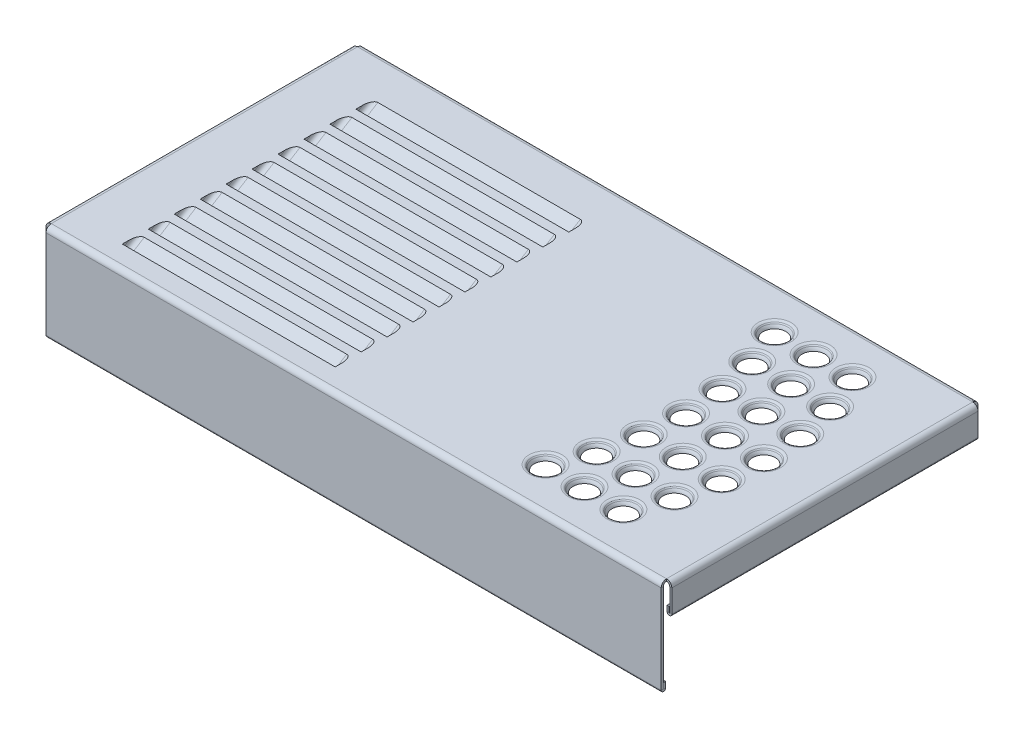
from build123d import *

# Parameters (mm, degrees)
SKETCH2_W               = 237
SKETCH2_H               = 0.8
BASE_FLANGE1_DEPTH      = 35
EDGE_FLANGE1_DEPTH      = 237
HEM1_START              = -118.5
HEM1_DEPTH              = 237
HEM1_2_DEPTH            = 237
EDGE_FLANGE2_DEPTH      = 237
EDGE_FLANGE3_DEPTH      = 117.95
EDGE_FLANGE3_BEND_DEPTH = 117.95
HEM2_START              = -119.2
HEM2_DEPTH              = 117.95
BOSS_EXTRUDE1_DEPTH     = 41.5
CUT_EXTRUDE1_DEPTH      = 41
FILLET2_R               = 2
LPATTERN2_COUNT         = 10
LPATTERN2_PITCH         = 10
FILLET2_OF_LPATTERN2_R  = 2
FILLET1_R               = 1.5
LPATTERN1_COUNT         = 3
LPATTERN1_PITCH         = 15
FILLET1_OF_LPATTERN1_R  = 1.5


# Read off the part's stored shape, not the designer's step: Hem1, Hem2, CrvPattern1
# Sheet-metal steps are written as plain solids
with BuildPart() as part:
    # Sketch2 → Base-Flange1 (new body)
    with BuildSketch(Plane(origin=(0, 0, 0), x_dir=(1, 0, 0), z_dir=(0, 1, 0))):
        with Locations((0, -0.4)):
            Rectangle(SKETCH2_W, SKETCH2_H)
    extrude(amount=BASE_FLANGE1_DEPTH)

    # Edge-Flange1 section (across the edge) → Edge-Flange1 (add)
    with BuildSketch(Plane(origin=(-118.5, 36.25, 0), x_dir=(0, -1, 0), z_dir=(1, 0, 0))):
        with BuildLine():
            Line((-0.8, 1.25), (-0.8, 119.2))
            Line((-0.8, 119.2), (0, 119.2))
            Line((0, 119.2), (0, 1.25))
            ThreePointArc((0, 1.25), (0.366116524, 0.366116524), (1.25, 0))
            Line((1.25, 0), (1.25, -0.8))
            ThreePointArc((1.25, -0.8), (-0.199568901, -0.199568901), (-0.8, 1.25))
        make_face()
    extrude(amount=EDGE_FLANGE1_DEPTH)

    # Hem1 outline → Hem1 (cut)
    with BuildSketch(Plane.YZ.offset(HEM1_START)):
        with BuildLine():
            Line((0, 0), (0.001471863, 0))
            ThreePointArc((0.001471863, 0), (0.266904811, 0.568465844), (0.85, 0.8))
            Line((0.85, 0.8), (0, 0.8))
            Line((0, 0.8), (0, 0))
        make_face()
    extrude(amount=HEM1_DEPTH, mode=Mode.SUBTRACT)

    # Hem1 2 outline → Hem1 2 (add)
    with BuildSketch(Plane.YZ.offset(HEM1_START)):
        with BuildLine():
            Line((3, -0.9), (3, -0.1))
            Line((3, -0.1), (0.85, -0.1))
            ThreePointArc((0.85, -0.1), (0.8, -0.05), (0.85, 0))
            Line((0.85, 0), (0.001471863, 0))
            ThreePointArc((0.001471863, 0), (0.231534156, -0.633095189), (0.85, -0.9))
            Line((0.85, -0.9), (3, -0.9))
        make_face()
    extrude(amount=HEM1_2_DEPTH)

    # Edge-Flange2 section (across the edge) → Edge-Flange2 (add)
    with BuildSketch(Plane(origin=(-118.5, 36.25, -120.45), x_dir=(0, 0, 1), z_dir=(1, 0, 0))):
        with BuildLine():
            Line((-0.8, 1.25), (-0.8, 5.5))
            Line((-0.8, 5.5), (0, 5.5))
            Line((0, 5.5), (0, 1.25))
            ThreePointArc((0, 1.25), (0.366116524, 0.366116524), (1.25, 0))
            Line((1.25, 0), (1.25, -0.8))
            ThreePointArc((1.25, -0.8), (-0.199568901, -0.199568901), (-0.8, 1.25))
        make_face()
    extrude(amount=EDGE_FLANGE2_DEPTH)

    # Edge-Flange3 section (across the edge) → Edge-Flange3 (add)
    with BuildSketch(Plane(origin=(119.75, 36.25, -119.2), x_dir=(-1, 0, 0), z_dir=(0, 0, 1))):
        with BuildLine():
            Line((-0.8, 1.25), (-0.8, 10))
            Line((-0.8, 10), (0, 10))
            Line((0, 10), (0, 1.25))
            ThreePointArc((0, 1.25), (0.366116524, 0.366116524), (1.25, 0))
            Line((1.25, 0), (1.25, -0.8))
            ThreePointArc((1.25, -0.8), (-0.199568901, -0.199568901), (-0.8, 1.25))
        make_face()
    extrude(amount=EDGE_FLANGE3_DEPTH)

    # Edge-Flange3 section 2 (across the edge) → Edge-Flange3 bend (add)
    with BuildSketch(Plane(origin=(-119.75, 36.25, -1.25), x_dir=(1, 0, 0), z_dir=(0, 0, -1))):
        with BuildLine():
            Line((-0.8, 1.25), (-0.8, 10))
            Line((-0.8, 10), (0, 10))
            Line((0, 10), (0, 1.25))
            ThreePointArc((0, 1.25), (0.366116524, 0.366116524), (1.25, 0))
            Line((1.25, 0), (1.25, -0.8))
            ThreePointArc((1.25, -0.8), (-0.199568901, -0.199568901), (-0.8, 1.25))
        make_face()
    extrude(amount=EDGE_FLANGE3_BEND_DEPTH)

    # Hem2 outline → Hem2 (add)
    with BuildSketch(Plane.XY.offset(HEM2_START)):
        with BuildLine():
            Line((-118.7, 28.325), (-119.5, 28.325))
            Line((-119.5, 28.325), (-119.5, 26.25))
            ThreePointArc((-119.5, 26.25), (-119.625, 26.125), (-119.75, 26.25))
            Line((-119.75, 26.25), (-120.55, 26.25))
            ThreePointArc((-120.55, 26.25), (-119.625, 25.325), (-118.7, 26.25))
            Line((-118.7, 26.25), (-118.7, 28.325))
        make_face()
        with BuildLine():
            Line((119.5, 28.325), (118.7, 28.325))
            Line((118.7, 28.325), (118.7, 26.25))
            ThreePointArc((118.7, 26.25), (119.625, 25.325), (120.55, 26.25))
            Line((120.55, 26.25), (119.75, 26.25))
            ThreePointArc((119.75, 26.25), (119.625, 26.125), (119.5, 26.25))
            Line((119.5, 26.25), (119.5, 28.325))
        make_face()
    extrude(amount=HEM2_DEPTH)

    # Sketch33 → Boss-Extrude1 (add, symmetric)
    with BuildSketch(Plane(origin=(-57, 0, 0), x_dir=(0, 0, -1), z_dir=(1, 0, 0))):
        Polygon((8.427939472, 37.05), (15.619582105, 37.05), (8.427939472, 32.316434555), align=None)
    boss_extrude1 = extrude(amount=BOSS_EXTRUDE1_DEPTH, both=True)

    # Sketch38 → Cut-Extrude1 (cut, symmetric)
    with BuildSketch(Plane(origin=(-57, 0, 0), x_dir=(0, 0, -1), z_dir=(1, 0, 0))):
        Polygon((8.096484885, 37.05), (8.096484885, 33.065998734), (14.556868485, 37.05), align=None)
    cut_extrude1 = extrude(amount=CUT_EXTRUDE1_DEPTH, both=True, mode=Mode.SUBTRACT)

    # Fillet2
    fillet2_edges = [part.edges().sort_by_distance(p)[0] for p in [
        (-98.5, 34.283217278, -11.416046142),
        (-15.5, 34.283217278, -11.416046142),
        (-98, 35.16020038, -11.492403979),
        (-16, 35.16020038, -11.492403979),
    ]]
    fillet(fillet2_edges, radius=FILLET2_R)

    # LPattern2: Boss-Extrude1, Cut-Extrude1 ×10
    with Locations(*[(0, 0, -i * LPATTERN2_PITCH) for i in range(1, LPATTERN2_COUNT)]):
        add(boss_extrude1)
        add(cut_extrude1, mode=Mode.SUBTRACT)

    # Fillet2 of LPattern2
    fillet2_of_lpattern2_edges = [part.edges().sort_by_distance(p)[0] for p in [
        (-98.5, 34.283217278, -21.416046142),
        (-15.5, 34.283217278, -21.416046142),
        (-98, 35.16020038, -21.492403979),
        (-16, 35.16020038, -21.492403979),
        (-98.5, 34.283217278, -31.416046142),
        (-15.5, 34.283217278, -31.416046142),
        (-98, 35.16020038, -31.492403979),
        (-16, 35.16020038, -31.492403979),
        (-98.5, 34.283217278, -41.416046142),
        (-15.5, 34.283217278, -41.416046142),
        (-98, 35.16020038, -41.492403979),
        (-16, 35.16020038, -41.492403979),
        (-98.5, 34.283217278, -51.416046142),
        (-15.5, 34.283217278, -51.416046142),
        (-98, 35.16020038, -51.492403979),
        (-16, 35.16020038, -51.492403979),
        (-98.5, 34.283217278, -61.416046142),
        (-15.5, 34.283217278, -61.416046142),
        (-98, 35.16020038, -61.492403979),
        (-16, 35.16020038, -61.492403979),
        (-98.5, 34.283217278, -71.416046142),
        (-15.5, 34.283217278, -71.416046142),
        (-98, 35.16020038, -71.492403979),
        (-16, 35.16020038, -71.492403979),
        (-98.5, 34.283217278, -81.416046142),
        (-15.5, 34.283217278, -81.416046142),
        (-98, 35.16020038, -81.492403979),
        (-16, 35.16020038, -81.492403979),
        (-98.5, 34.283217278, -91.416046142),
        (-15.5, 34.283217278, -91.416046142),
        (-98, 35.16020038, -91.492403979),
        (-16, 35.16020038, -91.492403979),
        (-98.5, 34.283217278, -101.416046142),
        (-15.5, 34.283217278, -101.416046142),
        (-98, 35.16020038, -101.492403979),
        (-16, 35.16020038, -101.492403979),
    ]]
    fillet(fillet2_of_lpattern2_edges, radius=FILLET2_OF_LPATTERN2_R)

    # Sketch28 → Revolve1 (revolve)
    with BuildSketch(Plane(origin=(0, 0, -104.35), x_dir=(-1, 0, 0), z_dir=(0, 0, -1)), mode=Mode.PRIVATE) as revolve1_sk:
        with BuildLine():
            Line((-87.05, 37.05), (-81.05, 37.05))
            ThreePointArc((-81.05, 37.05), (-81.860190211, 36.126407307), (-82.452456158, 35.05))
            Line((-82.452456158, 35.05), (-87.05, 35.05))
            Line((-87.05, 35.05), (-87.05, 37.05))
        make_face()
    revolve1 = revolve(revolve1_sk.sketch.rotate(Axis((87.05, 37.05, -104.35), (0, -1, 0)), 270), axis=Axis((87.05, 37.05, -104.35), (0, -1, 0)))

    # Sketch30 → Cut-Revolve1 (revolve, cut)
    with BuildSketch(Plane(origin=(0, 0, -104.35), x_dir=(-1, 0, 0), z_dir=(0, 0, -1)), mode=Mode.PRIVATE) as cut_revolve1_sk:
        with BuildLine():
            Line((-81.05, 37.05), (-87.05, 37.05))
            Line((-87.05, 37.05), (-87.05, 35.05))
            Line((-87.05, 35.05), (-82.675, 35.05))
            ThreePointArc((-82.675, 35.05), (-82.407298945, 35.684530837), (-82.014185903, 36.25))
            ThreePointArc((-82.014185903, 36.25), (-81.593720541, 36.724275567), (-81.05, 37.05))
        make_face()
    cut_revolve1 = revolve(cut_revolve1_sk.sketch.rotate(Axis((87.05, 37.05, -104.35), (0, -1, 0)), 270), axis=Axis((87.05, 37.05, -104.35), (0, -1, 0)), mode=Mode.SUBTRACT)

    # Fillet1
    fillet1_edges = [part.edges().sort_by_distance(p)[0] for p in [
        (87.05, 37.05, -110.35),
    ]]
    fillet(fillet1_edges, radius=FILLET1_R)

    # CrvPattern1 outline → CrvPattern1 (revolve)
    with BuildSketch(Plane(origin=(92.564388532, 0, -90.193165875), x_dir=(1, 0, 0), z_dir=(0, 0, 1))):
        with BuildLine():
            ThreePointArc((5.035814097, 36.25), (4.642701055, 35.684530837), (4.375, 35.05))
            Line((4.375, 35.05), (4.597543842, 35.05))
            ThreePointArc((4.597543842, 35.05), (4.901623924, 35.6708046), (5.27897752, 36.25))
            Line((5.27897752, 36.25), (5.035814097, 36.25))
        make_face()
    crvpattern1 = revolve(axis=Axis((92.564388532, 0, -90.193165875), (0, 1, 0)))

    # CrvPattern1 2 outline → CrvPattern1 2 (revolve)
    with BuildSketch(Plane(origin=(95.922385582, 0, -75.376003896), x_dir=(1, 0, 0), z_dir=(0, 0, 1))):
        with BuildLine():
            ThreePointArc((5.035814097, 36.25), (4.642701055, 35.684530837), (4.375, 35.05))
            Line((4.375, 35.05), (4.597543842, 35.05))
            ThreePointArc((4.597543842, 35.05), (4.901623924, 35.6708046), (5.27897752, 36.25))
            Line((5.27897752, 36.25), (5.035814097, 36.25))
        make_face()
    crvpattern1_2 = revolve(axis=Axis((95.922385582, 0, -75.376003896), (0, 1, 0)))

    # CrvPattern1 3 outline → CrvPattern1 3 (revolve)
    with BuildSketch(Plane(origin=(97.05, 0, -60.225), x_dir=(1, 0, 0), z_dir=(0, 0, 1))):
        with BuildLine():
            ThreePointArc((5.035814097, 36.25), (4.642701055, 35.684530837), (4.375, 35.05))
            Line((4.375, 35.05), (4.597543842, 35.05))
            ThreePointArc((4.597543842, 35.05), (4.901623924, 35.6708046), (5.27897752, 36.25))
            Line((5.27897752, 36.25), (5.035814097, 36.25))
        make_face()
    crvpattern1_3 = revolve(axis=Axis((97.05, 0, -60.225), (0, 1, 0)))

    # CrvPattern1 4 outline → CrvPattern1 4 (revolve)
    with BuildSketch(Plane(origin=(95.922385582, 0, -45.073996104), x_dir=(1, 0, 0), z_dir=(0, 0, 1))):
        with BuildLine():
            ThreePointArc((5.035814097, 36.25), (4.642701055, 35.684530837), (4.375, 35.05))
            Line((4.375, 35.05), (4.597543842, 35.05))
            ThreePointArc((4.597543842, 35.05), (4.901623924, 35.6708046), (5.27897752, 36.25))
            Line((5.27897752, 36.25), (5.035814097, 36.25))
        make_face()
    crvpattern1_4 = revolve(axis=Axis((95.922385582, 0, -45.073996104), (0, 1, 0)))

    # CrvPattern1 5 outline → CrvPattern1 5 (revolve)
    with BuildSketch(Plane(origin=(92.564388532, 0, -30.256834125), x_dir=(1, 0, 0), z_dir=(0, 0, 1))):
        with BuildLine():
            ThreePointArc((5.035814097, 36.25), (4.642701055, 35.684530837), (4.375, 35.05))
            Line((4.375, 35.05), (4.597543842, 35.05))
            ThreePointArc((4.597543842, 35.05), (4.901623924, 35.6708046), (5.27897752, 36.25))
            Line((5.27897752, 36.25), (5.035814097, 36.25))
        make_face()
    crvpattern1_5 = revolve(axis=Axis((92.564388532, 0, -30.256834125), (0, 1, 0)))

    # CrvPattern1 6 outline → CrvPattern1 6 (revolve)
    with BuildSketch(Plane(origin=(87.05, 0, -16.1), x_dir=(1, 0, 0), z_dir=(0, 0, 1))):
        with BuildLine():
            ThreePointArc((5.035814097, 36.25), (4.642701055, 35.684530837), (4.375, 35.05))
            Line((4.375, 35.05), (4.597543842, 35.05))
            ThreePointArc((4.597543842, 35.05), (4.901623924, 35.6708046), (5.27897752, 36.25))
            Line((5.27897752, 36.25), (5.035814097, 36.25))
        make_face()
    crvpattern1_6 = revolve(axis=Axis((87.05, 0, -16.1), (0, 1, 0)))

    # CrvPattern1 7 outline → CrvPattern1 7 (revolve, cut)
    with BuildSketch(Plane(origin=(92.564388532, 0, -90.193165875), x_dir=(1, 0, 0), z_dir=(0, 0, 1))):
        with BuildLine():
            Line((0, 36.25), (5.035814097, 36.25))
            ThreePointArc((5.035814097, 36.25), (5.192523402, 36.46228947), (5.374834085, 36.653044391))
            ThreePointArc((5.374834085, 36.653044391), (5.845710103, 36.947241315), (6.391344327, 37.05))
            Line((6.391344327, 37.05), (0, 37.05))
            Line((0, 37.05), (0, 36.25))
        make_face()
    crvpattern1_7 = revolve(axis=Axis((92.564388532, 0, -90.193165875), (0, 1, 0)), mode=Mode.SUBTRACT)

    # CrvPattern1 8 outline → CrvPattern1 8 (revolve, cut)
    with BuildSketch(Plane(origin=(95.922385582, 0, -75.376003896), x_dir=(1, 0, 0), z_dir=(0, 0, 1))):
        with BuildLine():
            Line((0, 36.25), (5.035814097, 36.25))
            ThreePointArc((5.035814097, 36.25), (5.192523402, 36.46228947), (5.374834085, 36.653044391))
            ThreePointArc((5.374834085, 36.653044391), (5.845710103, 36.947241315), (6.391344327, 37.05))
            Line((6.391344327, 37.05), (0, 37.05))
            Line((0, 37.05), (0, 36.25))
        make_face()
    crvpattern1_8 = revolve(axis=Axis((95.922385582, 0, -75.376003896), (0, 1, 0)), mode=Mode.SUBTRACT)

    # CrvPattern1 9 outline → CrvPattern1 9 (revolve, cut)
    with BuildSketch(Plane(origin=(97.05, 0, -60.225), x_dir=(1, 0, 0), z_dir=(0, 0, 1))):
        with BuildLine():
            Line((0, 36.25), (5.035814097, 36.25))
            ThreePointArc((5.035814097, 36.25), (5.192523402, 36.46228947), (5.374834085, 36.653044391))
            ThreePointArc((5.374834085, 36.653044391), (5.845710103, 36.947241315), (6.391344327, 37.05))
            Line((6.391344327, 37.05), (0, 37.05))
            Line((0, 37.05), (0, 36.25))
        make_face()
    crvpattern1_9 = revolve(axis=Axis((97.05, 0, -60.225), (0, 1, 0)), mode=Mode.SUBTRACT)

    # CrvPattern1 10 outline → CrvPattern1 10 (revolve, cut)
    with BuildSketch(Plane(origin=(95.922385582, 0, -45.073996104), x_dir=(1, 0, 0), z_dir=(0, 0, 1))):
        with BuildLine():
            Line((0, 36.25), (5.035814097, 36.25))
            ThreePointArc((5.035814097, 36.25), (5.192523402, 36.46228947), (5.374834085, 36.653044391))
            ThreePointArc((5.374834085, 36.653044391), (5.845710103, 36.947241315), (6.391344327, 37.05))
            Line((6.391344327, 37.05), (0, 37.05))
            Line((0, 37.05), (0, 36.25))
        make_face()
    crvpattern1_10 = revolve(axis=Axis((95.922385582, 0, -45.073996104), (0, 1, 0)), mode=Mode.SUBTRACT)

    # CrvPattern1 11 outline → CrvPattern1 11 (revolve, cut)
    with BuildSketch(Plane(origin=(92.564388532, 0, -30.256834125), x_dir=(1, 0, 0), z_dir=(0, 0, 1))):
        with BuildLine():
            Line((0, 36.25), (5.035814097, 36.25))
            ThreePointArc((5.035814097, 36.25), (5.192523402, 36.46228947), (5.374834085, 36.653044391))
            ThreePointArc((5.374834085, 36.653044391), (5.845710103, 36.947241315), (6.391344327, 37.05))
            Line((6.391344327, 37.05), (0, 37.05))
            Line((0, 37.05), (0, 36.25))
        make_face()
    crvpattern1_11 = revolve(axis=Axis((92.564388532, 0, -30.256834125), (0, 1, 0)), mode=Mode.SUBTRACT)

    # CrvPattern1 12 outline → CrvPattern1 12 (revolve, cut)
    with BuildSketch(Plane(origin=(87.05, 0, -16.1), x_dir=(1, 0, 0), z_dir=(0, 0, 1))):
        with BuildLine():
            Line((0, 36.25), (5.035814097, 36.25))
            ThreePointArc((5.035814097, 36.25), (5.192523402, 36.46228947), (5.374834085, 36.653044391))
            ThreePointArc((5.374834085, 36.653044391), (5.845710103, 36.947241315), (6.391344327, 37.05))
            Line((6.391344327, 37.05), (0, 37.05))
            Line((0, 37.05), (0, 36.25))
        make_face()
    crvpattern1_12 = revolve(axis=Axis((87.05, 0, -16.1), (0, 1, 0)), mode=Mode.SUBTRACT)

    # LPattern1: Revolve1, Cut-Revolve1, CrvPattern1, CrvPattern1 2, CrvPattern1 3, CrvPattern1 4, CrvPattern1 5, CrvPattern1 6, CrvPattern1 7, CrvPattern1 8, CrvPattern1 9, CrvPattern1 10, CrvPattern1 11, CrvPattern1 12 ×3
    with Locations(*[(-i * LPATTERN1_PITCH, 0, 0) for i in range(1, LPATTERN1_COUNT)]):
        add(revolve1)
        add(cut_revolve1, mode=Mode.SUBTRACT)
        add(crvpattern1)
        add(crvpattern1_2)
        add(crvpattern1_3)
        add(crvpattern1_4)
        add(crvpattern1_5)
        add(crvpattern1_6)
        add(crvpattern1_7, mode=Mode.SUBTRACT)
        add(crvpattern1_8, mode=Mode.SUBTRACT)
        add(crvpattern1_9, mode=Mode.SUBTRACT)
        add(crvpattern1_10, mode=Mode.SUBTRACT)
        add(crvpattern1_11, mode=Mode.SUBTRACT)
        add(crvpattern1_12, mode=Mode.SUBTRACT)

    # Fillet1 of LPattern1
    fillet1_of_lpattern1_edges = [part.edges().sort_by_distance(p)[0] for p in [
        (72.05, 37.05, -110.35),
        (57.05, 37.05, -110.35),
    ]]
    fillet(fillet1_of_lpattern1_edges, radius=FILLET1_OF_LPATTERN1_R)


solid = part.part
